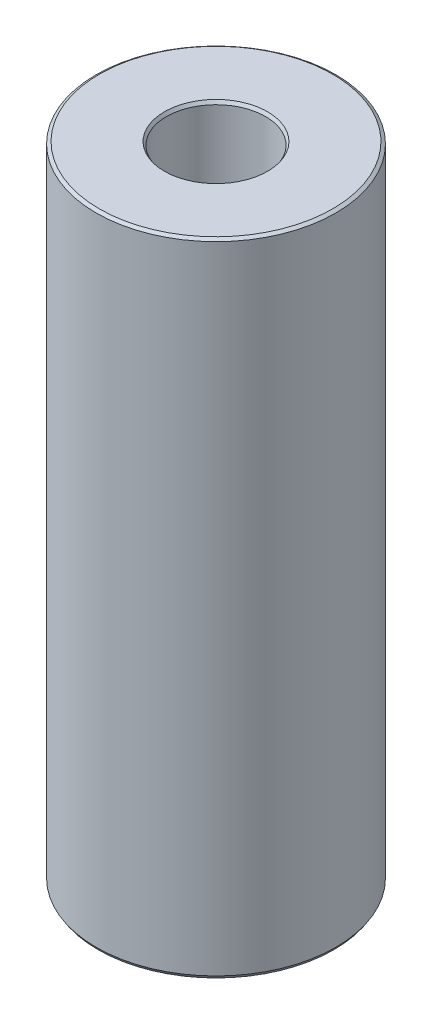
from build123d import *
from OCP.BRepFilletAPI import BRepFilletAPI_MakeChamfer

# Parameters (mm, degrees)
SKETCH1_R           = 25
BOSS_EXTRUDE1_DEPTH = 133.76001625
SKETCH2_R           = 10.344393221
CUT_EXTRUDE1_DEPTH  = 139.353684256
CHAMFER1_SIZE       = 0.418622396
CHAMFER1_SIZE2      = 0.658825722


with BuildPart() as part:
    # Sketch1 → Boss-Extrude1 (new body)
    with BuildSketch(Plane(origin=(0, 0, 0), x_dir=(1, 0, 0), z_dir=(0, 1, 0))):
        Circle(SKETCH1_R)
    extrude(amount=BOSS_EXTRUDE1_DEPTH)

    # Sketch2 → Cut-Extrude1 (cut, through all)
    with BuildSketch(Plane(origin=(0, 0, 0), x_dir=(1, 0, 0), z_dir=(0, 1, 0))):
        Circle(SKETCH2_R)
    extrude(amount=CUT_EXTRUDE1_DEPTH, mode=Mode.SUBTRACT)

    # Chamfer1: one chamfer whose edges measure the first distance from different faces: ONE call of the kernel's chamfer builder (chamfer() names one face for all edges)
    chamfer1_edges_1 = [part.edges().sort_by_distance(p)[0] for p in [
        (-10.344393221, 133.76001625, 0),
    ]]
    chamfer1_side_1 = [part.faces().sort_by_distance(p)[0] for p in [
        (-24.292893219, 133.76001625, 0),
    ]]
    chamfer1_edges_2 = [part.edges().sort_by_distance(p)[0] for p in [
        (-10.344393221, 0, 0),
    ]]
    chamfer1_side_2 = [part.faces().sort_by_distance(p)[0] for p in [
        (-10.344393221, 66.880008125, 0),
    ]]
    chamfer1_edges_3 = [part.edges().sort_by_distance(p)[0] for p in [
        (-25, 0, 0),
    ]]
    chamfer1_side_3 = [part.faces().sort_by_distance(p)[0] for p in [
        (-24.292893219, 0, 0),
    ]]
    chamfer1_edges_4 = [part.edges().sort_by_distance(p)[0] for p in [
        (-25, 133.76001625, 0),
    ]]
    chamfer1_side_4 = [part.faces().sort_by_distance(p)[0] for p in [
        (-25, 66.880008125, 0),
    ]]
    chamfer1 = BRepFilletAPI_MakeChamfer(part.part.solid().wrapped)
    for e in chamfer1_edges_1:
        chamfer1.Add(CHAMFER1_SIZE, CHAMFER1_SIZE2, e.wrapped, chamfer1_side_1[0].wrapped)  # the first distance lies on this face
    for e in chamfer1_edges_2:
        chamfer1.Add(CHAMFER1_SIZE, CHAMFER1_SIZE2, e.wrapped, chamfer1_side_2[0].wrapped)  # the first distance lies on this face
    for e in chamfer1_edges_3:
        chamfer1.Add(CHAMFER1_SIZE, CHAMFER1_SIZE2, e.wrapped, chamfer1_side_3[0].wrapped)  # the first distance lies on this face
    for e in chamfer1_edges_4:
        chamfer1.Add(CHAMFER1_SIZE, CHAMFER1_SIZE2, e.wrapped, chamfer1_side_4[0].wrapped)  # the first distance lies on this face
    add(Compound.cast(chamfer1.Shape()), mode=Mode.REPLACE)


solid = part.part
